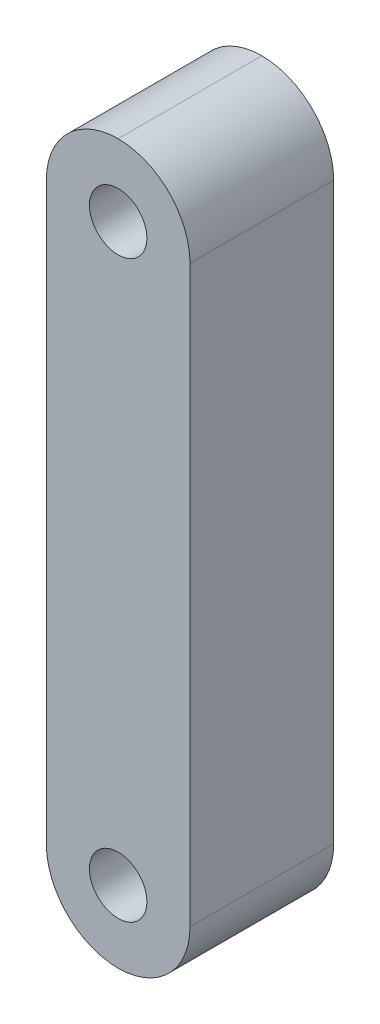
from build123d import *

# Parameters (mm, degrees)
ESQUISSE1_W             = 10
ESQUISSE1_H             = 50
BOSS_EXTRU_1_DEPTH      = 10
ESQUISSE2_R             = 2
ENL_V_MAT_EXTRU_1_DEPTH = 10
CONG_1_R                = 5


with BuildPart() as part:
    # Esquisse1 → Boss.-Extru.1 (new body)
    with BuildSketch(Plane.XY):
        with Locations((5, 25)):
            Rectangle(ESQUISSE1_W, ESQUISSE1_H)
    extrude(amount=BOSS_EXTRU_1_DEPTH)

    # Esquisse2 → Enlèv. mat.-Extru.1 (cut)
    with BuildSketch(Plane.XY.offset(10)):
        with Locations((5, 45)):
            Circle(ESQUISSE2_R)
        with Locations((5, 5)):
            Circle(ESQUISSE2_R)
    extrude(amount=-ENL_V_MAT_EXTRU_1_DEPTH, mode=Mode.SUBTRACT)

    # Congé1
    cong_1_edges = [part.edges().sort_by_distance(p)[0] for p in [
        (10, 50, 5),
        (0, 50, 5),
        (10, 0, 5),
        (0, 0, 5),
    ]]
    fillet(cong_1_edges, radius=CONG_1_R - 0.0001)  # a hair under: the kernel refuses the full size


solid = part.part
